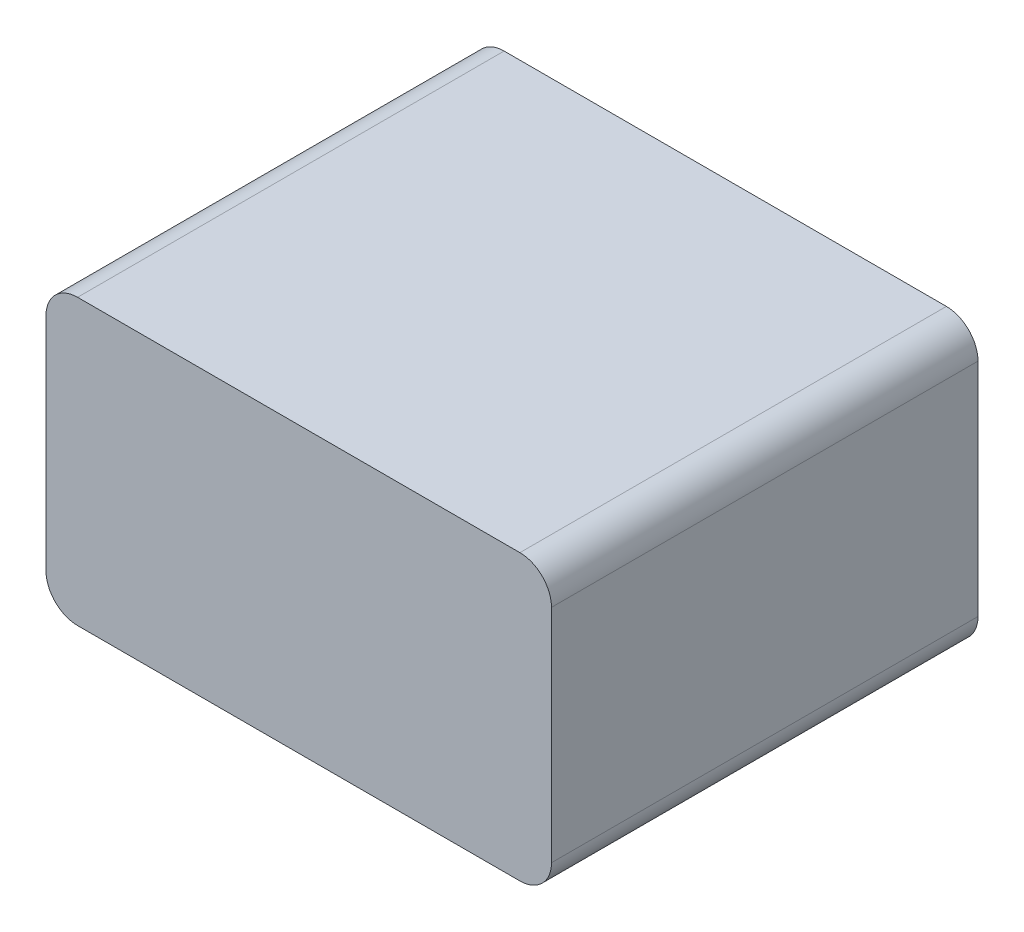
from build123d import *

# Parameters (mm, degrees)
BOSS_EXTRUDE1_DEPTH = 65
BOSS_EXTRUDE2_DEPTH = 2.5


with BuildPart() as part:
    # Sketch2 → Boss-Extrude1 (new body)
    with BuildSketch(Plane.XY):
        with BuildLine():
            ThreePointArc((-40, -17.5), (-38.535533906, -21.035533906), (-35, -22.5))
            Line((-35, -22.5), (35, -22.5))
            ThreePointArc((35, -22.5), (38.535533906, -21.035533906), (40, -17.5))
            Line((40, -17.5), (40, 17.5))
            ThreePointArc((40, 17.5), (38.535533906, 21.035533906), (35, 22.5))
            Line((35, 22.5), (-35, 22.5))
            ThreePointArc((-35, 22.5), (-38.535533906, 21.035533906), (-40, 17.5))
            Line((-40, 17.5), (-40, -17.5))
        make_face()
        with BuildLine():
            ThreePointArc((37.5, -15), (36.035533906, -18.535533906), (32.5, -20))
            Line((32.5, -20), (-32.5, -20))
            ThreePointArc((-32.5, -20), (-36.035533906, -18.535533906), (-37.5, -15))
            Line((-37.5, -15), (-37.5, 15))
            ThreePointArc((-37.5, 15), (-36.035533906, 18.535533906), (-32.5, 20))
            Line((-32.5, 20), (32.5, 20))
            ThreePointArc((32.5, 20), (36.035533906, 18.535533906), (37.5, 15))
            Line((37.5, 15), (37.5, -15))
        make_face(mode=Mode.SUBTRACT)
    extrude(amount=BOSS_EXTRUDE1_DEPTH)

    # Sketch3 → Boss-Extrude2 (add)
    with BuildSketch(Plane.XY.offset(65)):
        with BuildLine():
            Line((-40, 17.5), (-40, -17.5))
            ThreePointArc((-40, -17.5), (-38.535533906, -21.035533906), (-35, -22.5))
            Line((-35, -22.5), (35, -22.5))
            ThreePointArc((35, -22.5), (38.535533906, -21.035533906), (40, -17.5))
            Line((40, -17.5), (40, 17.5))
            ThreePointArc((40, 17.5), (38.535533906, 21.035533906), (35, 22.5))
            Line((35, 22.5), (-35, 22.5))
            ThreePointArc((-35, 22.5), (-38.535533906, 21.035533906), (-40, 17.5))
        make_face()
    extrude(amount=BOSS_EXTRUDE2_DEPTH)


solid = part.part
